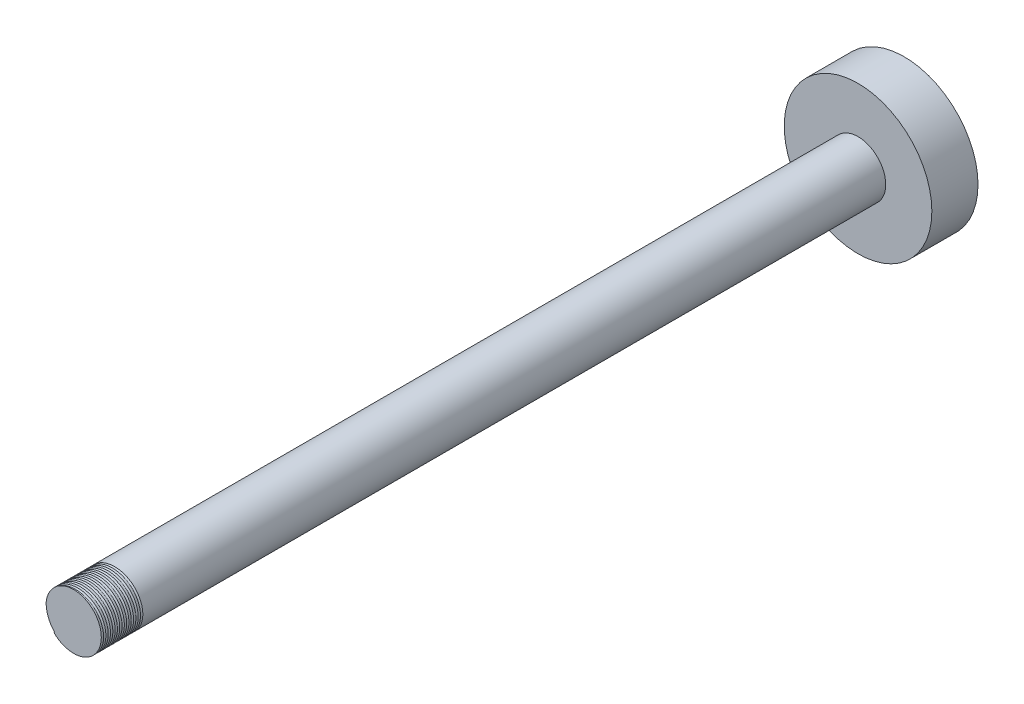
from build123d import *

# Parameters (mm, degrees)
SKETCH1_R           = 16
BOSS_EXTRUDE1_DEPTH = 10
SKETCH2_R           = 6
BOSS_EXTRUDE2_DEPTH = 170
CUT_SWEEP2_PITCH    = 1


with BuildPart() as part:
    # Sketch1 → Boss-Extrude1 (new body)
    with BuildSketch(Plane.XY):
        Circle(SKETCH1_R)
    extrude(amount=BOSS_EXTRUDE1_DEPTH)

    # Sketch2 → Boss-Extrude2 (add)
    with BuildSketch(Plane.XY.offset(10)):
        Circle(SKETCH2_R)
    extrude(amount=BOSS_EXTRUDE2_DEPTH)

    # Cut-Sweep2: arcs per turn and ends read off the stored shape
    # Cut-Sweep2: the profile of Sketch8 screwed along a right-hand helix through 9 turns, 8 arcs to a turn; built about Z, then put on its axis
    cut_sweep2_z = Axis((0, 0, 0), (0, 0, 1))
    cut_sweep2_corners = [(5.75, 0, 0.11502314), (6, 0, 0.36502314), (6.25, 0, 0.11502314), (6, 0, -0.13497686)]
    with BuildLine(mode=Mode.PRIVATE) as cut_sweep2_profile:
        ThreePointArc((5.75, 0, 0.11502314), (5.823223305, 0, 0.291799835), (6, 0, 0.36502314))
        ThreePointArc((6, 0, 0.36502314), (6.176776695, 0, 0.291799835), (6.25, 0, 0.11502314))
        ThreePointArc((6.25, 0, 0.11502314), (6.176776695, 0, -0.061753555), (6, 0, -0.13497686))
        ThreePointArc((6, 0, -0.13497686), (5.823223305, 0, -0.061753555), (5.75, 0, 0.11502314))
    cut_sweep2_cap = Face(cut_sweep2_profile.wire())
    cut_sweep2_arcs = [((5.75, 0, 0.11502314), (5.75, 0, 0.36502314), (6, 0, 0.36502314), (1, 0.7071067811865476, 1)), ((6, 0, 0.36502314), (6.25, 0, 0.36502314), (6.25, 0, 0.11502314), (1, 0.7071067811865476, 1)), ((6.25, 0, 0.11502314), (6.25, 0, -0.13497686), (6, 0, -0.13497686), (1, 0.7071067811865476, 1)), ((6, 0, -0.13497686), (5.75, 0, -0.13497686), (5.75, 0, 0.11502314), (1, 0.7071067811865476, 1))]  # start, shoulder, end, weights
    cut_sweep2_turn_angles = [0, 22.5, 45, 67.5, 90, 112.5, 135, 157.5, 180, 202.5, 225, 247.5, 270, 292.5, 315, 337.5, 360]
    cut_sweep2_turn_weights = [1, 0.9238795325112867, 1, 0.9238795325112867, 1, 0.9238795325112867, 1, 0.9238795325112867, 1, 0.9238795325112867, 1, 0.9238795325112867, 1, 0.9238795325112867, 1, 0.9238795325112867, 1]
    cut_sweep2_turn_sides = [Face.make_bezier_surface([[Vector(p[j][0], p[j][1], 0).rotate(cut_sweep2_z, cut_sweep2_turn_angles[2 * i + k]) / cut_sweep2_turn_weights[2 * i + k] + Vector(0, 0, p[j][2] + CUT_SWEEP2_PITCH * cut_sweep2_turn_angles[2 * i + k] / 360) for k in range(3)] for j in range(3)], [[p[3][j] * cut_sweep2_turn_weights[2 * i + k] for k in range(3)] for j in range(3)]) for p in cut_sweep2_arcs for i in range(8)]
    cut_sweep2 = Plane(origin=(0, 0, 180), x_dir=(-0.7071067811865414, -0.7071067811865537, 0), z_dir=(0, 0, -1)) * Solid(Shell([*[p.moved(Location((0, 0, CUT_SWEEP2_PITCH * i))) for i in range(9) for p in cut_sweep2_turn_sides], cut_sweep2_cap, cut_sweep2_cap.rotate(cut_sweep2_z, 3240).moved(Location((0, 0, CUT_SWEEP2_PITCH * 3240 / 360)))]))
    add(cut_sweep2, mode=Mode.SUBTRACT)


solid = part.part
